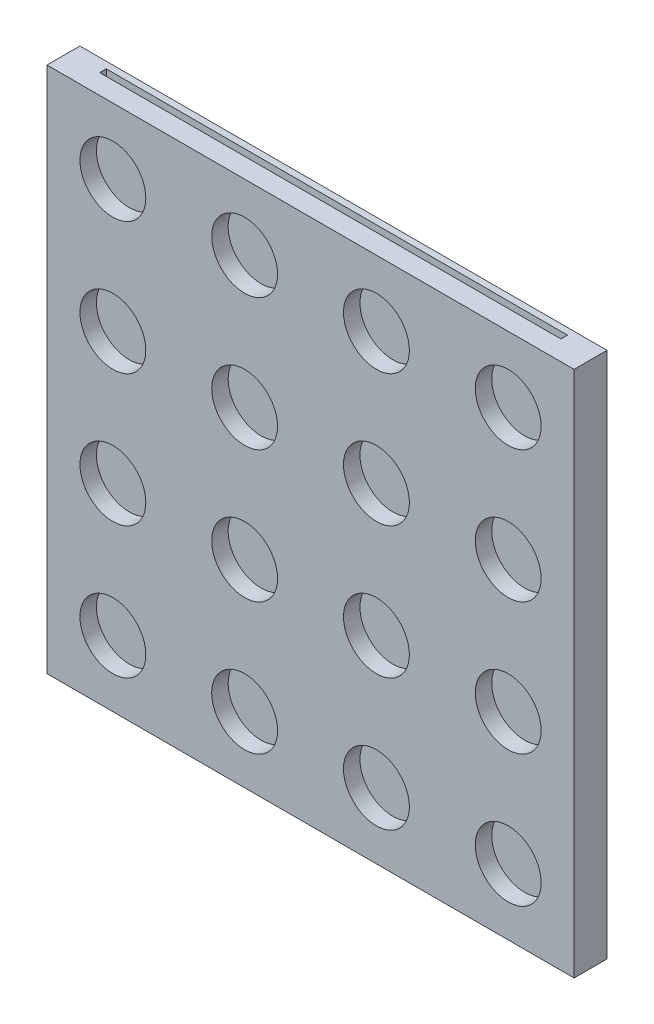
from build123d import *

# Parameters (mm, degrees)
SKETCH1_W           = 101.6
SKETCH1_H           = 101.6
BOSS_EXTRUDE1_DEPTH = 6.35
SKETCH3_R           = 6.35
CUT_EXTRUDE2_DEPTH  = 3.175
SKETCH4_W           = 88.9
SKETCH4_H           = 88.9
CUT_EXTRUDE3_DEPTH  = 2.54
CUT_EXTRUDE4_REACH  = 145.824
SKETCH5_W           = 88.9
SKETCH5_H           = 1.27


with BuildPart() as part:
    # Sketch1 → Boss-Extrude1 (new body)
    with BuildSketch(Plane.XY):
        with Locations((50.8, 50.8)):
            Rectangle(SKETCH1_W, SKETCH1_H)
    extrude(amount=BOSS_EXTRUDE1_DEPTH)

    # Sketch3 → Cut-Extrude2 (cut)
    with BuildSketch(Plane.XY.offset(6.35)):
        with Locations((12.7, 139.7)):
            Circle(SKETCH3_R)
        with Locations((38.1, 139.7)):
            Circle(SKETCH3_R)
        with Locations((63.5, 139.7)):
            Circle(SKETCH3_R)
        with Locations((88.9, 139.7)):
            Circle(SKETCH3_R)
        with Locations((88.9, 114.3)):
            Circle(SKETCH3_R)
        with Locations((63.5, 114.3)):
            Circle(SKETCH3_R)
        with Locations((38.1, 114.3)):
            Circle(SKETCH3_R)
        with Locations((12.7, 114.3)):
            Circle(SKETCH3_R)
        with Locations((88.9, 88.9)):
            Circle(SKETCH3_R)
        with Locations((63.5, 88.9)):
            Circle(SKETCH3_R)
        with Locations((38.1, 88.9)):
            Circle(SKETCH3_R)
        with Locations((12.7, 88.9)):
            Circle(SKETCH3_R)
        with Locations((88.9, 63.5)):
            Circle(SKETCH3_R)
        with Locations((63.5, 63.5)):
            Circle(SKETCH3_R)
        with Locations((38.1, 63.5)):
            Circle(SKETCH3_R)
        with Locations((12.7, 63.5)):
            Circle(SKETCH3_R)
        with Locations((88.9, 38.1)):
            Circle(SKETCH3_R)
        with Locations((63.5, 38.1)):
            Circle(SKETCH3_R)
        with Locations((38.1, 38.1)):
            Circle(SKETCH3_R)
        with Locations((12.7, 38.1)):
            Circle(SKETCH3_R)
        with Locations((88.9, 12.7)):
            Circle(SKETCH3_R)
        with Locations((63.5, 12.7)):
            Circle(SKETCH3_R)
        with Locations((38.1, 12.7)):
            Circle(SKETCH3_R)
        with Locations((12.7, 12.7)):
            Circle(SKETCH3_R)
    extrude(amount=-CUT_EXTRUDE2_DEPTH, mode=Mode.SUBTRACT)

    # Sketch4 → Cut-Extrude3 (cut)
    with BuildSketch(Plane(origin=(0, 0, 0), x_dir=(-1, 0, 0), z_dir=(0, 0, -1))):
        with Locations((-50.8, 50.8)):
            Rectangle(SKETCH4_W, SKETCH4_H)
    extrude(amount=-CUT_EXTRUDE3_DEPTH, mode=Mode.SUBTRACT)

    # Sketch5 → Cut-Extrude4 (cut, up to next)
    with BuildSketch(Plane(origin=(0, 101.6, 0), x_dir=(1, 0, 0), z_dir=(0, 1, 0)), mode=Mode.PRIVATE) as cut_extrude4_sk1:
        with Locations((50.8, -1.905)):
            Rectangle(SKETCH5_W, SKETCH5_H)
    cut_extrude4_tool1 = extrude(cut_extrude4_sk1.sketch, amount=-CUT_EXTRUDE4_REACH, mode=Mode.PRIVATE) & part.part
    add(cut_extrude4_tool1.solids().sort_by_distance((50.8, 101.6, 1.905))[0], mode=Mode.SUBTRACT)


solid = part.part
